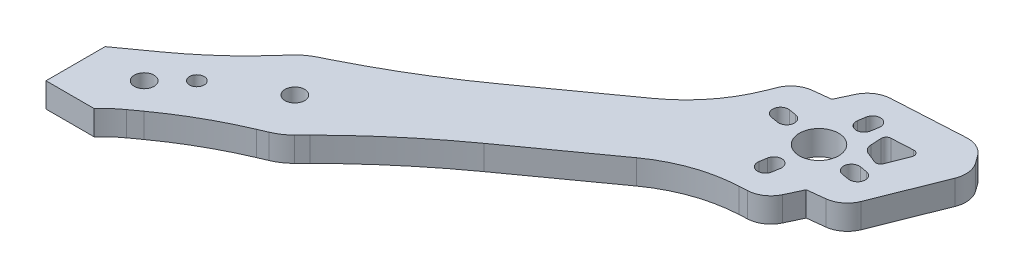
from build123d import *

# Parameters (mm, degrees)
SKETCH2_R           = 2
SKETCH2_R_2         = 1.5
SKETCH2_R_3         = 4
BOSS_EXTRUDE1_DEPTH = 5


with BuildPart() as part:
    # Sketch2 → Boss-Extrude1 (new body)
    with BuildSketch(Plane(origin=(0, 0, 0), x_dir=(1, 0, 0), z_dir=(0, 1, 0))):
        with BuildLine():
            Line((96.674187099, 58.214174471), (100.259554689, 58.62537792))
            ThreePointArc((100.259554689, 58.62537792), (102.726861183, 59.620848143), (104.334258678, 61.740950876))
            Line((104.334258678, 61.740950876), (109.788302134, 75.41951978))
            ThreePointArc((109.788302134, 75.41951978), (110.106786378, 77.879348033), (109.203962948, 80.189563845))
            Line((109.203962948, 80.189563845), (108.148744134, 81.65769437))
            ThreePointArc((108.148744134, 81.65769437), (106.246786582, 83.249782532), (103.813742867, 83.731950064))
            Line((103.813742867, 83.731950064), (89.110198155, 82.922252473))
            ThreePointArc((89.110198155, 82.922252473), (86.58833532, 82.074449344), (84.858361795, 80.053124553))
            Line((84.858361795, 80.053124553), (83.325812901, 76.785825529))
            Line((83.325812901, 76.785825529), (79.745407576, 76.375191199))
            ThreePointArc((79.745407576, 76.375191199), (77.270804519, 75.374131292), (75.6639264, 73.24253003))
            Line((75.6639264, 73.24253003), (75.042843012, 71.6680711))
            ThreePointArc((75.042843012, 71.6680711), (70.946054903, 64.491253119), (64.991367673, 58.761323876))
            Line((64.991367673, 58.761323876), (46.931722679, 45.780954047))
            ThreePointArc((46.931722679, 45.780954047), (36.413241445, 38.843477801), (25.372306119, 32.77184118))
            Line((25.372306119, 32.77184118), (23.401205332, 31.788764494))
            ThreePointArc((23.401205332, 31.788764494), (21.793071121, 30.786042702), (20.402989885, 29.497935256))
            Line((20.402989885, 29.497935256), (19.112268572, 28.051458372))
            ThreePointArc((19.112268572, 28.051458372), (13.16458677, 22.078961314), (6.599736248, 16.792338805))
            Line((6.599736248, 16.792338805), (0, 12.048778377))
            Line((0, 12.048778377), (0, 0))
            Line((0, 0), (9.827416163, 0))
            ThreePointArc((9.827416163, 0), (11.473121255, 1.662110783), (13.293458997, 3.130895317))
            Line((13.293458997, 3.130895317), (15.354276971, 4.612108235))
            ThreePointArc((15.354276971, 4.612108235), (22.457631343, 9.149507995), (30.014371949, 12.883314543))
            Line((30.014371949, 12.883314543), (31.796806607, 13.645668513))
            ThreePointArc((31.796806607, 13.645668513), (33.460801696, 14.552678424), (34.923797775, 15.757331529))
            Line((34.923797775, 15.757331529), (36.483864554, 17.312281519))
            ThreePointArc((36.483864554, 17.312281519), (45.757987001, 25.842092678), (55.686263447, 33.60072351))
            Line((55.686263447, 33.60072351), (73.745908403, 46.581093312))
            ThreePointArc((73.745908403, 46.581093312), (81.074965721, 50.398855458), (89.183263316, 51.994442832))
            Line((89.183263316, 51.994442832), (90.873565855, 52.081292528))
            ThreePointArc((90.873565855, 52.081292528), (93.406161944, 52.924938353), (95.143759302, 54.951397494))
            Line((95.143759302, 54.951397494), (96.674187099, 58.214174471))
        make_face()
        with Locations((10.000016395, 10.000011804)):
            Circle(SKETCH2_R, mode=Mode.SUBTRACT)
        with Locations((27.864354565, 22.840004863)):
            Circle(SKETCH2_R, mode=Mode.SUBTRACT)
        with Locations((15.365, 15.365)):
            Circle(SKETCH2_R_2, mode=Mode.SUBTRACT)
        with Locations((90, 67.5)):
            Circle(SKETCH2_R_3, mode=Mode.SUBTRACT)
        with BuildLine():
            Line((100.618872181, 76.169797692), (96.189048483, 75.92936815))
            ThreePointArc((96.189048483, 75.92936815), (95.498854377, 75.598583427), (95.244713564, 74.876642374))
            Line((95.244713564, 74.876642374), (95.363815249, 72.682238728))
            ThreePointArc((95.363815249, 72.682238728), (95.736845201, 71.623357489), (96.621599456, 70.932278091))
            Line((96.621599456, 70.932278091), (98.663587114, 70.119948739))
            ThreePointArc((98.663587114, 70.119948739), (99.428878121, 70.130724305), (99.962401105, 70.679486242))
            Line((99.962401105, 70.679486242), (101.602243357, 74.8016291))
            ThreePointArc((101.602243357, 74.8016291), (101.485082981, 75.754903393), (100.618872181, 76.169797692))
        make_face(mode=Mode.SUBTRACT)
        with BuildLine():
            Line((99.116926829, 64.38685927), (97.636614954, 64.629092122))
            ThreePointArc((97.636614954, 64.629092122), (96.315997331, 66.466473164), (98.153378372, 67.787090788))
            Line((98.153378372, 67.787090788), (99.633690247, 67.544857936))
            ThreePointArc((99.633690247, 67.544857936), (100.95430787, 65.707476894), (99.116926829, 64.38685927))
        make_face(mode=Mode.SUBTRACT)
        with BuildLine():
            Line((93.11314073, 76.616926829), (92.870907878, 75.136614954))
            ThreePointArc((92.870907878, 75.136614954), (91.033526836, 73.815997331), (89.712909212, 75.653378372))
            Line((89.712909212, 75.653378372), (89.955142064, 77.133690247))
            ThreePointArc((89.955142064, 77.133690247), (91.792523106, 78.45430787), (93.11314073, 76.616926829))
        make_face(mode=Mode.SUBTRACT)
        with BuildLine():
            Line((80.366309753, 67.455142064), (81.846621628, 67.212909212))
            ThreePointArc((81.846621628, 67.212909212), (83.684002669, 68.533526836), (82.363385046, 70.370907878))
            Line((82.363385046, 70.370907878), (80.883073171, 70.61314073))
            ThreePointArc((80.883073171, 70.61314073), (79.04569213, 69.292523106), (80.366309753, 67.455142064))
        make_face(mode=Mode.SUBTRACT)
        with BuildLine():
            Line((90.044857936, 57.866309753), (90.287090788, 59.346621628))
            ThreePointArc((90.287090788, 59.346621628), (88.966473164, 61.184002669), (87.129092122, 59.863385046))
            Line((87.129092122, 59.863385046), (86.88685927, 58.383073171))
            ThreePointArc((86.88685927, 58.383073171), (88.207476894, 56.54569213), (90.044857936, 57.866309753))
        make_face(mode=Mode.SUBTRACT)
    extrude(amount=BOSS_EXTRUDE1_DEPTH)


solid = part.part
